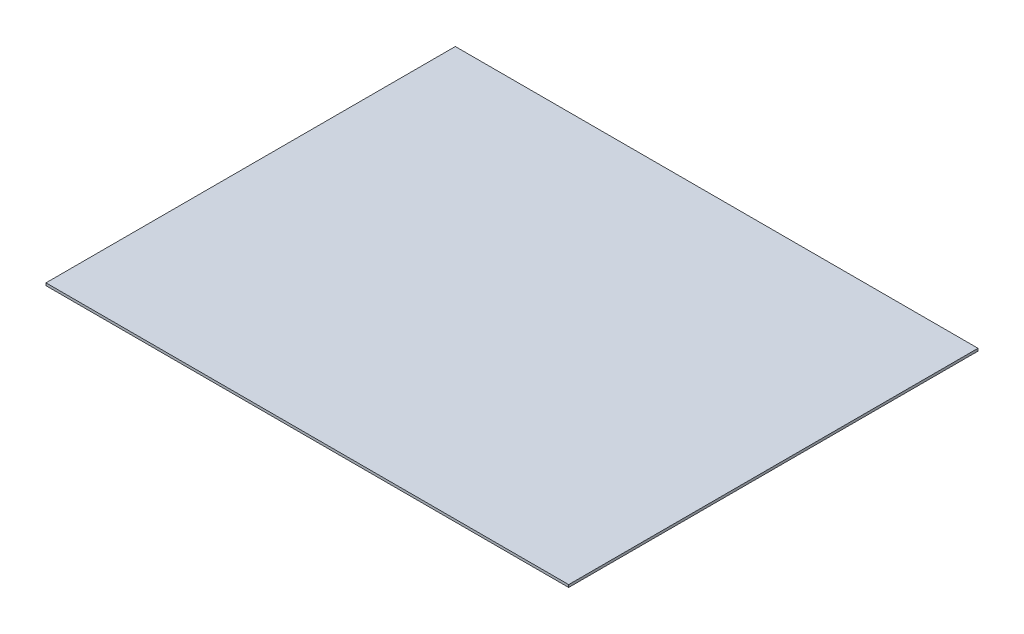
from build123d import *

# Parameters (mm, degrees)
SKETCH1_W           = 249
SKETCH1_H           = 195
BOSS_EXTRUDE1_DEPTH = 1.2


with BuildPart() as part:
    # Sketch1 → Boss-Extrude1 (new body)
    with BuildSketch(Plane(origin=(0, 0, 0), x_dir=(1, 0, 0), z_dir=(0, 1, 0))):
        Rectangle(SKETCH1_W, SKETCH1_H)
    extrude(amount=BOSS_EXTRUDE1_DEPTH)


solid = part.part
